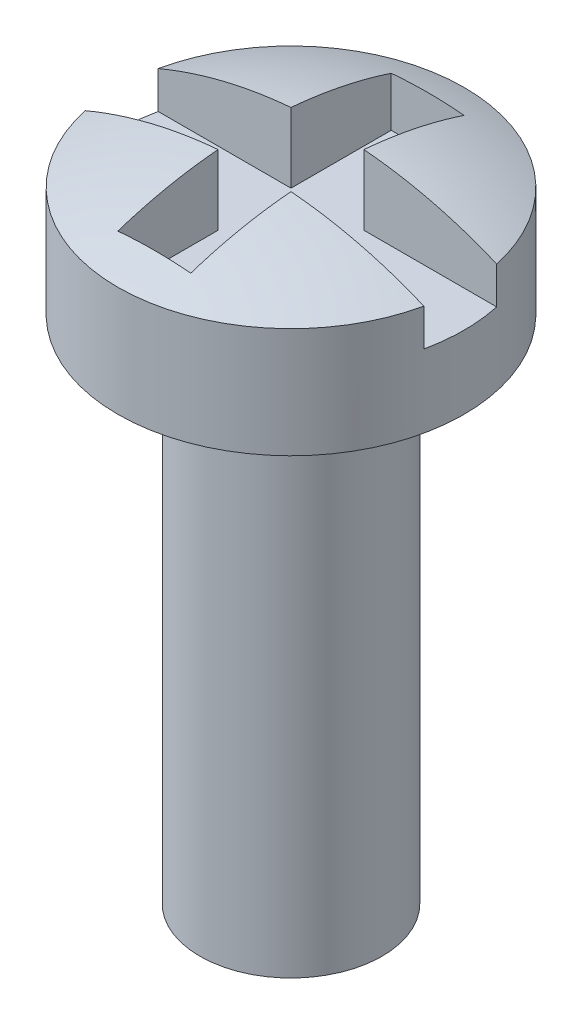
from build123d import *

# Parameters (mm, degrees)
SKETCH_1_R          = 1.25
EXTRUDE_1_DEPTH     = 7
SKETCH_2_R          = 2.375
EXTRUDE_2_DEPTH     = 2
SKETCH_3_W          = 7.004697232
SKETCH_3_H          = 1
CUT_EXTRUDE_1_DEPTH = 1
SKETCH_4_W          = 1
SKETCH_4_H          = 3.75
CUT_EXTRUDE_2_DEPTH = 1


with BuildPart() as part:
    # 草图1 → 拉伸1 (new body)
    with BuildSketch(Plane(origin=(0, 0, 0), x_dir=(1, 0, 0), z_dir=(0, 1, 0))):
        Circle(SKETCH_1_R)
    extrude(amount=EXTRUDE_1_DEPTH)

    # 草图2 → 拉伸2 (add)
    with BuildSketch(Plane(origin=(0, 7, 0), x_dir=(-1, 0, 0), z_dir=(0, 1, 0))):
        Circle(SKETCH_2_R)
    extrude(amount=EXTRUDE_2_DEPTH)

    # 草图3 → 切除-拉伸1 (cut)
    with BuildSketch(Plane(origin=(0, 9, 0), x_dir=(-1, 0, 0), z_dir=(0, 1, 0))):
        Rectangle(SKETCH_3_W, SKETCH_3_H)
    extrude(amount=-CUT_EXTRUDE_1_DEPTH, mode=Mode.SUBTRACT)

    # 草图4 → 切除-拉伸2 (cut)
    with BuildSketch(Plane(origin=(0, 9, 0), x_dir=(-1, 0, 0), z_dir=(0, 1, 0))):
        Rectangle(SKETCH_4_W, SKETCH_4_H)
    extrude(amount=-CUT_EXTRUDE_2_DEPTH, mode=Mode.SUBTRACT)

    # 草图5 → 切除-旋转16 (revolve, cut)
    with BuildSketch(Plane(origin=(0, 0, 0), x_dir=(0, 0, -1), z_dir=(1, 0, 0))):
        with BuildLine():
            Line((0, 10.999822694), (-4.5493707, 10.999822694))
            Line((-4.5493707, 10.999822694), (-4.5493707, 6.911933822))
            ThreePointArc((-4.5493707, 6.911933822), (-2.502838096, 8.453054325), (0, 9))
            Line((0, 9), (0, 10.999822694))
        make_face()
    revolve(axis=Axis((0, -2.105917543, 0), (0, 1, 0)), mode=Mode.SUBTRACT)


solid = part.part
